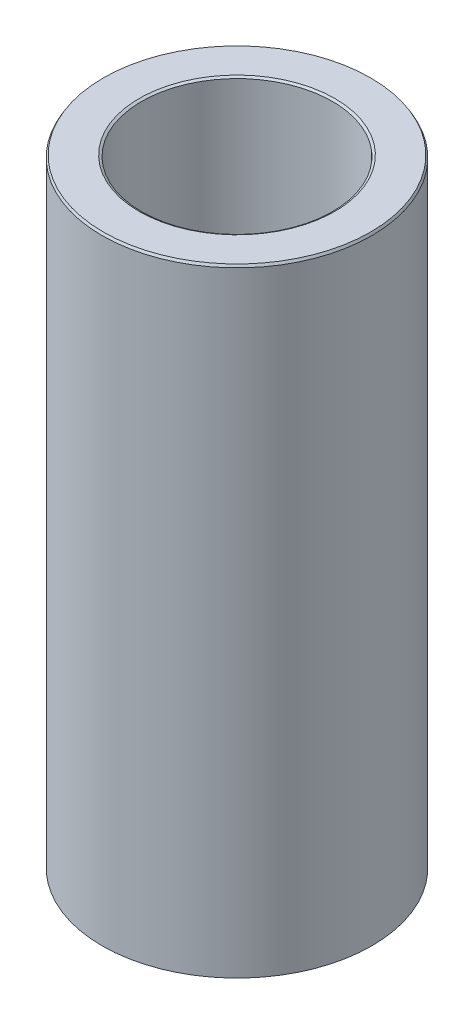
from build123d import *
from OCP.BRepFilletAPI import BRepFilletAPI_MakeChamfer

# Parameters (mm, degrees)
SKETCH1_R           = 60
BOSS_EXTRUDE1_DEPTH = 275.163872599
SKETCH2_R           = 42.455578356
CUT_EXTRUDE1_DEPTH  = 288.949920618
CHAMFER1_SIZE       = 1.05449206
CHAMFER1_SIZE2      = 0.608811275


with BuildPart() as part:
    # Sketch1 → Boss-Extrude1 (new body)
    with BuildSketch(Plane(origin=(0, 0, 0), x_dir=(1, 0, 0), z_dir=(0, 1, 0))):
        Circle(SKETCH1_R)
    extrude(amount=BOSS_EXTRUDE1_DEPTH)

    # Sketch2 → Cut-Extrude1 (cut, through all)
    with BuildSketch(Plane(origin=(0, 0, 0), x_dir=(1, 0, 0), z_dir=(0, 1, 0))):
        Circle(SKETCH2_R)
    extrude(amount=CUT_EXTRUDE1_DEPTH, mode=Mode.SUBTRACT)

    # Chamfer1: one chamfer whose edges measure the first distance from different faces: ONE call of the kernel's chamfer builder (chamfer() names one face for all edges)
    chamfer1_edges_1 = [part.edges().sort_by_distance(p)[0] for p in [
        (-42.455578356, 275.163872599, 0),
    ]]
    chamfer1_side_1 = [part.faces().sort_by_distance(p)[0] for p in [
        (-58.302943725, 275.163872599, 0),
    ]]
    chamfer1_edges_2 = [part.edges().sort_by_distance(p)[0] for p in [
        (-42.455578356, 0, 0),
    ]]
    chamfer1_side_2 = [part.faces().sort_by_distance(p)[0] for p in [
        (-42.455578356, 137.5819363, 0),
    ]]
    chamfer1_edges_3 = [part.edges().sort_by_distance(p)[0] for p in [
        (-60, 0, 0),
    ]]
    chamfer1_side_3 = [part.faces().sort_by_distance(p)[0] for p in [
        (-58.302943725, 0, 0),
    ]]
    chamfer1_edges_4 = [part.edges().sort_by_distance(p)[0] for p in [
        (-60, 275.163872599, 0),
    ]]
    chamfer1_side_4 = [part.faces().sort_by_distance(p)[0] for p in [
        (-60, 137.5819363, 0),
    ]]
    chamfer1 = BRepFilletAPI_MakeChamfer(part.part.solid().wrapped)
    for e in chamfer1_edges_1:
        chamfer1.Add(CHAMFER1_SIZE, CHAMFER1_SIZE2, e.wrapped, chamfer1_side_1[0].wrapped)  # the first distance lies on this face
    for e in chamfer1_edges_2:
        chamfer1.Add(CHAMFER1_SIZE, CHAMFER1_SIZE2, e.wrapped, chamfer1_side_2[0].wrapped)  # the first distance lies on this face
    for e in chamfer1_edges_3:
        chamfer1.Add(CHAMFER1_SIZE, CHAMFER1_SIZE2, e.wrapped, chamfer1_side_3[0].wrapped)  # the first distance lies on this face
    for e in chamfer1_edges_4:
        chamfer1.Add(CHAMFER1_SIZE, CHAMFER1_SIZE2, e.wrapped, chamfer1_side_4[0].wrapped)  # the first distance lies on this face
    add(Compound.cast(chamfer1.Shape()), mode=Mode.REPLACE)


solid = part.part
